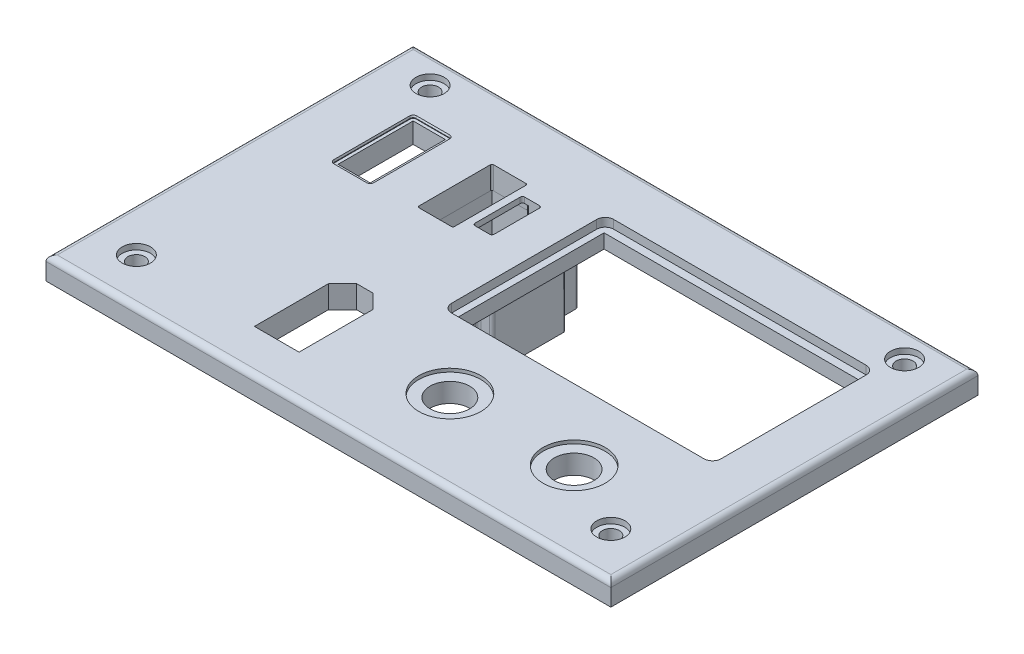
from build123d import *
from OCP.BRepFilletAPI import BRepFilletAPI_MakeChamfer

# Parameters (mm, degrees)
SKETCH_1_W             = 100
SKETCH_1_H             = 65
EXTRUDE_307_DEPTH      = 4
SKETCH_2_W             = 47.7
SKETCH_2_H             = 28.7
CUT_EXTRUDE_542_DEPTH  = 1.5
FILLET_597_R           = 1.5
SKETCH_3_W             = 45.3
SKETCH_3_H             = 25.9
CUT_EXTRUDE_1214_DEPTH = 3
SKETCH_5_R             = 5.5
CUT_EXTRUDE_1569_DEPTH = 0.6
SKETCH_7_W             = 6.8
SKETCH_7_H             = 14.4
USB_DEPTH              = 0.4
SKETCH_8_W             = 5.7
SKETCH_8_H             = 13.3
USB_2_DEPTH            = 70.555445509
F_1_USB_R              = 0.5
XT60_DEPTH             = 70.577295147
SKETCH_10_R            = 1.5
CUT_EXTRUDE_3801_DEPTH = 70.577295147
SKETCH_13_R            = 2.5
CUT_EXTRUDE_4325_DEPTH = 1
FILLET_1_R             = 1
CUT_EXTRUDE_1_DEPTH    = 70.577295147
FILLET_2_R             = 0.4
FILLET_3_R             = 0.3
SKETCH_15_W            = 1.3
SKETCH_15_H            = 18.4
EXTRUDE_1_DEPTH        = 1
FILLET_4_R             = 0.3
FILLET_5_R             = 0.4
EXTRUDE_1_2_DEPTH      = 15
FILLET_6_R             = 0.5
SKETCH_18_W            = 1.090661214
SKETCH_18_H            = 18.299056271
CUT_EXTRUDE_2_DEPTH    = 3
CHAMFER_2_SIZE         = 0.139892297
CHAMFER_2_SIZE_2       = 0.3
CHAMFER_3_SIZE         = 0.3
CHAMFER_3_SIZE_2       = 0.139892297
CHAMFER_4_SIZE         = 0.3
CHAMFER_4_SIZE2        = 0.139892297
SKETCH_21_R            = 3.5
CUT_EXTRUDE_3_DEPTH    = 10


with BuildPart() as part:
    # Sketch 1 → Extrude 307 (new body)
    with BuildSketch(Plane(origin=(0, 0, 0), x_dir=(1, 0, 0), z_dir=(0, 1, 0))):
        with Locations((-10, -2.5)):
            Rectangle(SKETCH_1_W, SKETCH_1_H)
    extrude(amount=EXTRUDE_307_DEPTH)

    # Sketch 2 → Cut-Extrude 542 (cut)
    with BuildSketch(Plane(origin=(0, 4, 0), x_dir=(1, 0, 0), z_dir=(0, 1, 0))):
        with Locations((7.15, 6.35)):
            Rectangle(SKETCH_2_W, SKETCH_2_H)
    extrude(amount=-CUT_EXTRUDE_542_DEPTH, mode=Mode.SUBTRACT)

    # Fillet 597
    fillet_597_edges = [part.edges().sort_by_distance(p)[0] for p in [
        (-16.7, 3.25, 8),
        (-16.7, 3.25, -20.7),
        (31, 3.25, -20.7),
        (31, 3.25, 8),
    ]]
    fillet(fillet_597_edges, radius=FILLET_597_R)

    # Sketch 3 → Cut-Extrude 1214 (cut)
    with BuildSketch(Plane(origin=(0, 2.5, 0), x_dir=(1, 0, 0), z_dir=(0, 1, 0))):
        with Locations((7.15, 6.35)):
            Rectangle(SKETCH_3_W, SKETCH_3_H)
    extrude(amount=-CUT_EXTRUDE_1214_DEPTH, mode=Mode.SUBTRACT)

    # Sketch 5 → Cut-Extrude 1569 (cut)
    with BuildSketch(Plane(origin=(0, 4, 0), x_dir=(1, 0, 0), z_dir=(0, 1, 0))):
        with Locations(Location((19, -20.5, 0), (0, 0, 270))):
            Circle(SKETCH_5_R)
        with Locations(Location((-3, -20.5, 0), (0, 0, 270))):
            Circle(SKETCH_5_R)
    extrude(amount=-CUT_EXTRUDE_1569_DEPTH, mode=Mode.SUBTRACT)

    # Sketch 7 → USB (cut)
    with BuildSketch(Plane(origin=(0, 4, 0), x_dir=(1, 0, 0), z_dir=(0, 1, 0))):
        with Locations((-45.6, 11.8)):
            Rectangle(SKETCH_7_W, SKETCH_7_H)
    extrude(amount=-USB_DEPTH, mode=Mode.SUBTRACT)

    # Sketch 8 → USB 2 (cut, through all)
    with BuildSketch(Plane(origin=(0, 3.6, 0), x_dir=(1, 0, 0), z_dir=(0, 1, 0))):
        with Locations((-45.6, 11.8)):
            Rectangle(SKETCH_8_W, SKETCH_8_H)
    extrude(amount=-USB_2_DEPTH, mode=Mode.SUBTRACT)

    # 1 USB
    f_1_usb_edges = [part.edges().sort_by_distance(p)[0] for p in [
        (-42.2, 3.8, -19),
        (-42.2, 3.8, -4.6),
        (-49, 3.8, -4.6),
        (-49, 3.8, -19),
    ]]
    fillet(f_1_usb_edges, radius=F_1_USB_R)

    # Sketch 9 → XT60 (cut, through all)
    with BuildSketch(Plane(origin=(0, 4, 0), x_dir=(1, 0, 0), z_dir=(0, 1, 0))):
        Polygon((-30.6, -27.5), (-22.7, -27.5), (-22.7, -14.4), (-25.2, -11.9), (-28.1, -11.9), (-30.6, -14.4), align=None)
    extrude(amount=-XT60_DEPTH, mode=Mode.SUBTRACT)

    # Sketch 10 → Cut-Extrude 3801 (cut, through all)
    with BuildSketch(Plane(origin=(0, 4, 0), x_dir=(1, 0, 0), z_dir=(0, 1, 0))):
        with Locations(Location((-52, 25, 0), (0, 0, 270))):
            Circle(SKETCH_10_R)
        with Locations(Location((32, 25, 0), (0, 0, 270))):
            Circle(SKETCH_10_R)
        with Locations(Location((32, -27, 0), (0, 0, 270))):
            Circle(SKETCH_10_R)
        with Locations(Location((-52, -27, 0), (0, 0, 270))):
            Circle(SKETCH_10_R)
    extrude(amount=-CUT_EXTRUDE_3801_DEPTH, mode=Mode.SUBTRACT)

    # Sketch 13 → Cut-Extrude 4325 (cut)
    with BuildSketch(Plane(origin=(0, 4, 0), x_dir=(1, 0, 0), z_dir=(0, 1, 0))):
        with Locations(Location((-52, 25, 0), (0, 0, 270))):
            Circle(SKETCH_13_R)
        with Locations(Location((32, 25, 0), (0, 0, 270))):
            Circle(SKETCH_13_R)
        with Locations(Location((32, -27, 0), (0, 0, 270))):
            Circle(SKETCH_13_R)
        with Locations(Location((-52, -27, 0), (0, 0, 270))):
            Circle(SKETCH_13_R)
    extrude(amount=-CUT_EXTRUDE_4325_DEPTH, mode=Mode.SUBTRACT)

    # Fillet 1
    fillet_1_edges = [part.edges().sort_by_distance(p)[0] for p in [
        (-60, 4, 2.5),
        (-10, 4, 35),
        (40, 4, 2.5),
        (-10, 4, -30),
    ]]
    fillet(fillet_1_edges, radius=FILLET_1_R)

    # Sketch 14 → Cut-Extrude 1 (cut, through all)
    with BuildSketch(Plane(origin=(0, 4, 0), x_dir=(1, 0, 0), z_dir=(0, 1, 0))):
        Polygon((-28.2, 5.25), (-34.5, 5.25), (-34.5, 18.45), (-28.2, 18.45), (-28.2, 21), (-26.9, 21.000000245), (-26.9, 16.250000245), (-23.5, 16.250000245), (-23.5, 7.450000245), (-26.9, 7.450000245), (-26.9, 2.700000245), (-28.2, 2.7), align=None)
    extrude(amount=-CUT_EXTRUDE_1_DEPTH, mode=Mode.SUBTRACT)

    # Fillet 2
    fillet_2_edges = [part.edges().sort_by_distance(p)[0] for p in [
        (-23.5, 2, -16.250000245),
        (-23.5, 2, -7.450000245),
    ]]
    fillet(fillet_2_edges, radius=FILLET_2_R)

    # Fillet 3
    fillet_3_edges = [part.edges().sort_by_distance(p)[0] for p in [
        (-34.5, 2, -5.25),
        (-34.5, 2, -18.45),
    ]]
    fillet(fillet_3_edges, radius=FILLET_3_R)

    # Sketch 15 → Extrude 1 (add)
    with BuildSketch(Plane(origin=(0, 4, 0), x_dir=(1, 0, 0), z_dir=(0, 1, 0))):
        with Locations((-27.55, 11.900000122)):
            Rectangle(SKETCH_15_W, SKETCH_15_H)
    extrude(amount=-EXTRUDE_1_DEPTH)

    # Fillet 4
    fillet_4_edges = [part.edges().sort_by_distance(p)[0] for p in [
        (-28.2, 3.5, -5.25),
        (-28.2, 3.5, -18.45),
    ]]
    fillet(fillet_4_edges, radius=FILLET_4_R)

    # Fillet 5
    fillet_5_edges = [part.edges().sort_by_distance(p)[0] for p in [
        (-26.9, 3.5, -16.250000245),
        (-26.9, 3.5, -7.450000245),
    ]]
    fillet(fillet_5_edges, radius=FILLET_5_R)

    # Sketch 17 → Extrude 1 2 (add)
    with BuildSketch(Plane.XZ):
        Polygon((-36.618386658, -3.143776534), (-30.309338786, -3.143776534), (-30.309338786, -0.700943974), (-23.809338786, -0.700943974), (-23.809338786, -5.317320465), (-21.309338786, -5.317320465), (-21.309338786, -18.393213758), (-23.809338786, -18.393213758), (-23.809338786, -23.1022888), (-30.309338786, -23.1022888), (-30.309338786, -20.556223466), (-36.618386658, -20.556223466), align=None)
        Polygon((-34.618386658, -5.143776534), (-28.309338786, -5.143776534), (-28.309338786, -2.700943974), (-25.809338786, -2.700943974), (-25.809338786, -7.317320465), (-23.309338786, -7.317320465), (-23.309338786, -16.393213758), (-25.809338786, -16.393213758), (-25.809338786, -21.1022888), (-28.309338786, -21.1022888), (-28.309338786, -18.556223466), (-34.618386658, -18.556223466), align=None, mode=Mode.SUBTRACT)
    extrude(amount=EXTRUDE_1_2_DEPTH)

    # Fillet 6
    fillet_6_edges = [part.edges().sort_by_distance(p)[0] for p in [
        (-36.618386658, -7.5, -3.143776534),
        (-36.618386658, -7.5, -20.556223466),
        (-30.309338786, -7.5, -20.556223466),
        (-30.309338786, -7.5, -23.1022888),
        (-23.809338786, -7.5, -23.1022888),
        (-23.809338786, -7.5, -18.393213758),
        (-21.309338786, -7.5, -18.393213758),
        (-21.309338786, -7.5, -5.317320465),
        (-23.809338786, -7.5, -5.317320465),
        (-23.809338786, -7.5, -0.700943974),
        (-30.309338786, -7.5, -0.700943974),
        (-30.309338786, -7.5, -3.143776534),
    ]]
    fillet(fillet_6_edges, radius=FILLET_6_R)

    # Sketch 18 → Cut-Extrude 2 (cut)
    with BuildSketch(Plane.XZ):
        with Locations((-26.354669393, -11.85047211)):
            Rectangle(SKETCH_18_W, SKETCH_18_H)
    extrude(amount=-CUT_EXTRUDE_2_DEPTH, mode=Mode.SUBTRACT)

    # Chamfer 2
    # the kernel refuses this chamfer: 0.3, 0.139892297 mm, written as the material it takes off along each edge
    with BuildSketch(Plane(origin=(-23.5, 0, -7.850000245), x_dir=(0.9971975577536777, -0.07481330637059809, 0), z_dir=(0, 0, -1))) as chamfer_2_piece_1:
        Polygon((CHAMFER_2_SIZE * 0.997197560936, -CHAMFER_2_SIZE * 0.0748133066094), (-CHAMFER_2_SIZE_2 * 0.0748133063706, -CHAMFER_2_SIZE_2 * 0.997197557754), (0, 0), align=None)
    extrude(amount=8, mode=Mode.SUBTRACT)
    with BuildSketch(Plane(origin=(-23.9, 0, -16.250000245), x_dir=(0, -0.07481330637059809, -0.9971975577536777), z_dir=(-1, 0, 0))) as chamfer_2_piece_2:
        Polygon((CHAMFER_2_SIZE * 0.997197560936, -CHAMFER_2_SIZE * 0.0748133066094), (-CHAMFER_2_SIZE_2 * 0.0748133063706, -CHAMFER_2_SIZE_2 * 0.997197557754), (0, 0), align=None)
    extrude(amount=2.686631428, mode=Mode.SUBTRACT)
    with BuildSketch(Plane(origin=(-23.9, 0, -7.850000245), x_dir=(1, 0, 0), z_dir=(0, 0, -1))) as chamfer_2_piece_3_section:
        Polygon((0.4 + CHAMFER_2_SIZE * 1.00000000319, 0), (0.4, -CHAMFER_2_SIZE_2), (0.4, 0), align=None)
    chamfer_2_piece_3 = revolve(axis=Axis((-23.9, 0, -7.850000245), (0, -1, 0)), revolution_arc=90, mode=Mode.PRIVATE)
    chamfer_2_piece_3 = split(chamfer_2_piece_3, bisect_by=Plane(origin=(-23.615169446, 0.09811856, -7.317320465), z_dir=(0, 0, -1)), keep=Keep.TOP, mode=Mode.PRIVATE)
    add(chamfer_2_piece_3, mode=Mode.SUBTRACT)
    with BuildSketch(Plane(origin=(-23.9, 0, -15.850000245), x_dir=(0, 0, -1), z_dir=(-1, 0, 0))) as chamfer_2_piece_4:
        Polygon((0.4 + CHAMFER_2_SIZE * 1.00000000319, 0), (0.4, -CHAMFER_2_SIZE_2), (0.4, 0), align=None)
    revolve(axis=Axis((-23.9, 0, -15.850000245), (0, -1, 0)), revolution_arc=90, mode=Mode.SUBTRACT)
    with BuildSketch(Plane(origin=(-26.586631428, 0, -7.450000245), x_dir=(0, -0.07481330637059899, 0.9971975577536775), z_dir=(1, 0, 0))) as chamfer_2_piece_5_section:
        Polygon((CHAMFER_2_SIZE * 0.997197560936, -CHAMFER_2_SIZE * 0.0748133066094), (-CHAMFER_2_SIZE_2 * 0.0748133063706, -CHAMFER_2_SIZE_2 * 0.997197557754), (0, 0), align=None)
    chamfer_2_piece_5 = extrude(amount=2.686631428, mode=Mode.PRIVATE)
    chamfer_2_piece_5 = split(chamfer_2_piece_5, bisect_by=Plane(origin=(-25.243315714, 0.102442856, -7.317320465), z_dir=(0, 0, -1)), keep=Keep.TOP, mode=Mode.PRIVATE)
    add(chamfer_2_piece_5, mode=Mode.SUBTRACT)

    # Chamfer 3
    # the kernel refuses this chamfer: 0.3, 0.139892297 mm, written as the material it takes off along each edge
    with BuildSketch(Plane(origin=(-26.9, 0, -21.000000245), x_dir=(3.0703872584113996e-09, 0.9998669641130701, 0.01631116413112706), z_dir=(-0.9999999999999823, 0, 1.8823838897875096e-07))) as chamfer_3_piece_1_section:
        Polygon((CHAMFER_3_SIZE * 0.999866964113, CHAMFER_3_SIZE * 0.0163111641311), (-CHAMFER_3_SIZE_2 * 0.0163111641832, CHAMFER_3_SIZE_2 * 0.999866967304), (0, 0), align=None)
    chamfer_3_piece_1 = extrude(amount=1.3, mode=Mode.PRIVATE)
    chamfer_3_piece_1 = split(chamfer_3_piece_1, bisect_by=Plane(origin=(-27.550000111, 0.109074509, -21.1022888), z_dir=(0, 0, 1)), keep=Keep.TOP, mode=Mode.PRIVATE)
    add(chamfer_3_piece_1, mode=Mode.SUBTRACT)
    with BuildSketch(Plane(origin=(-28.2, 0, -21), x_dir=(0.016311164131115632, 0.9998669641130703, 0), z_dir=(0, 0, 1))) as chamfer_3_piece_2_section:
        Polygon((CHAMFER_3_SIZE * 0.999866964113, CHAMFER_3_SIZE * 0.0163111641311), (-CHAMFER_3_SIZE_2 * 0.0163111641832, CHAMFER_3_SIZE_2 * 0.999866967304), (0, 0), align=None)
    chamfer_3_piece_2 = extrude(amount=3.327292641, mode=Mode.PRIVATE)
    chamfer_3_piece_2 = split(chamfer_3_piece_2, bisect_by=Plane(origin=(-28.309338786, 0.10709581, -19.77811173), z_dir=(1, 0, 0)), keep=Keep.TOP, mode=Mode.PRIVATE)
    chamfer_3_piece_2 = split(chamfer_3_piece_2, bisect_by=Plane(origin=(-28.239160304, 0.10709581, -18.556223466), z_dir=(0, 0, -1)), keep=Keep.TOP, mode=Mode.PRIVATE)
    add(chamfer_3_piece_2, mode=Mode.SUBTRACT)
    with BuildSketch(Plane(origin=(-28.2, 0, -21), x_dir=(0.016311164131115632, 0.9998669641130703, 0), z_dir=(0, 0, 1))) as chamfer_3_piece_3_section:
        Polygon((CHAMFER_3_SIZE * 0.999866964113, CHAMFER_3_SIZE * 0.0163111641311), (-CHAMFER_3_SIZE_2 * 0.0163111641832, CHAMFER_3_SIZE_2 * 0.999866967304), (0, 0), align=None)
    chamfer_3_piece_3 = extrude(amount=3.327292641, mode=Mode.PRIVATE)
    chamfer_3_piece_3 = split(chamfer_3_piece_3, bisect_by=Plane(origin=(-28.309338786, 0.10709581, -18.114465412), z_dir=(1, 0, 0)), keep=Keep.TOP, mode=Mode.PRIVATE)
    chamfer_3_piece_3 = split(chamfer_3_piece_3, bisect_by=Plane(origin=(-28.239160304, 0.10709581, -18.556223466), z_dir=(0, 0, 1)), keep=Keep.TOP, mode=Mode.PRIVATE)
    add(chamfer_3_piece_3, mode=Mode.SUBTRACT)
    with BuildSketch(Plane(origin=(-28.2, 0, -21), x_dir=(0.016311164131115632, 0.9998669641130703, 0), z_dir=(0, 0, 1))) as chamfer_3_piece_4_section:
        Polygon((CHAMFER_3_SIZE * 0.999866964113, CHAMFER_3_SIZE * 0.0163111641311), (-CHAMFER_3_SIZE_2 * 0.0163111641832, CHAMFER_3_SIZE_2 * 0.999866967304), (0, 0), align=None)
    chamfer_3_piece_4 = extrude(amount=3.327292641, mode=Mode.PRIVATE)
    chamfer_3_piece_4 = split(chamfer_3_piece_4, bisect_by=Plane(origin=(-28.309338786, 0.012963641, -18.114465412), z_dir=(-1, 0, 0)), keep=Keep.TOP, mode=Mode.PRIVATE)
    chamfer_3_piece_4 = split(chamfer_3_piece_4, bisect_by=Plane(origin=(-28.322057693, 0.012963641, -18.556223466), z_dir=(0, 0, 1)), keep=Keep.TOP, mode=Mode.PRIVATE)
    add(chamfer_3_piece_4, mode=Mode.SUBTRACT)
    with BuildSketch(Plane(origin=(-26.9, 0, -21.000000245), x_dir=(0, 0.9998669641130703, 0.016311164131115625), z_dir=(1, 0, 0))) as chamfer_3_piece_5_section:
        Polygon((CHAMFER_3_SIZE * 0.999866964113, -CHAMFER_3_SIZE * 0.0163111641311), (-CHAMFER_3_SIZE_2 * 0.0163111641832, -CHAMFER_3_SIZE_2 * 0.999866967304), (0, 0), align=None)
    chamfer_3_piece_5 = extrude(amount=1.090661214, mode=Mode.PRIVATE)
    chamfer_3_piece_5 = split(chamfer_3_piece_5, bisect_by=Plane(origin=(-26.354669393, 0.109074546, -21.1022888), z_dir=(0, 0, 1)), keep=Keep.TOP, mode=Mode.PRIVATE)
    add(chamfer_3_piece_5, mode=Mode.SUBTRACT)
    with BuildSketch(Plane(origin=(-26.9, 0, -21.000000245), x_dir=(3.0703872584113996e-09, 0.9998669641130701, 0.01631116413112706), z_dir=(-0.9999999999999823, 0, 1.8823838897875096e-07))) as chamfer_3_piece_6a_section:
        Polygon((CHAMFER_3_SIZE * 0.999866964113, CHAMFER_3_SIZE * 0.0163111641311), (-CHAMFER_3_SIZE_2 * 0.0163111641832, CHAMFER_3_SIZE_2 * 0.999866967304), (0, 0), align=None)
    chamfer_3_piece_6a = extrude(amount=2.077292641, mode=Mode.PRIVATE)
    chamfer_3_piece_6a = split(chamfer_3_piece_6a, bisect_by=Plane(origin=(-28.254669395, 0.10907447, -21.1022888), z_dir=(0, 0, 1)), keep=Keep.TOP, mode=Mode.PRIVATE)
    chamfer_3_piece_6a = split(chamfer_3_piece_6a, bisect_by=Plane(origin=(-28.309338786, 0.10907447, -21.037410409), z_dir=(1, 0, 0)), keep=Keep.TOP, mode=Mode.PRIVATE)
    chamfer_3_piece_6a = split(chamfer_3_piece_6a, bisect_by=Plane(origin=(-28.2, 0.10907447, -21.037410409), z_dir=(-1, 0, 0)), keep=Keep.TOP, mode=Mode.PRIVATE)
    with BuildSketch(Plane(origin=(-28.2, 0, -21.777292641), x_dir=(0.016311164131115632, 0.9998669641130703, 0), z_dir=(0, 0, 1))) as chamfer_3_piece_6b_section:
        Polygon((CHAMFER_3_SIZE * 0.999866964113, CHAMFER_3_SIZE * 0.0163111641311), (-CHAMFER_3_SIZE_2 * 0.0163111641832, CHAMFER_3_SIZE_2 * 0.999866967304), (0, 0), align=None)
    chamfer_3_piece_6b = extrude(amount=4.104585283, mode=Mode.PRIVATE)
    chamfer_3_piece_6b = split(chamfer_3_piece_6b, bisect_by=Plane(origin=(-28.239160306, 0.107095809, -21.1022888), z_dir=(0, 0, 1)), keep=Keep.TOP, mode=Mode.PRIVATE)
    chamfer_3_piece_6b = split(chamfer_3_piece_6b, bisect_by=Plane(origin=(-28.309338786, 0.107095809, -21.051144397), z_dir=(1, 0, 0)), keep=Keep.TOP, mode=Mode.PRIVATE)
    chamfer_3_piece_6b = split(chamfer_3_piece_6b, bisect_by=Plane(origin=(-28.239160296, 0.107095809, -20.999999993), z_dir=(-1.8823838897875096e-07, 0, -0.9999999999999823)), keep=Keep.TOP, mode=Mode.PRIVATE)
    chamfer_3_piece_6 = chamfer_3_piece_6a & chamfer_3_piece_6b
    add(chamfer_3_piece_6, mode=Mode.SUBTRACT)

    # Chamfer 4: one chamfer whose edges measure the first distance from different faces: ONE call of the kernel's chamfer builder (chamfer() names one face for all edges)
    chamfer_4_edges_1 = [part.edges().sort_by_distance(p)[0] for p in [
        (-45.6, 4, -4.6),
    ]]
    chamfer_4_side_1 = [part.faces().sort_by_distance(p)[0] for p in [
        (-45.6, 3.8, -4.6),
    ]]
    chamfer_4_edges_2 = [part.edges().sort_by_distance(p)[0] for p in [
        (-49, 4, -11.8),
    ]]
    chamfer_4_side_2 = [part.faces().sort_by_distance(p)[0] for p in [
        (-49, 3.8, -11.8),
    ]]
    chamfer_4_edges_3 = [part.edges().sort_by_distance(p)[0] for p in [
        (-42.2, 4, -11.8),
    ]]
    chamfer_4_side_3 = [part.faces().sort_by_distance(p)[0] for p in [
        (-42.2, 3.8, -11.8),
    ]]
    chamfer_4_edges_4 = [part.edges().sort_by_distance(p)[0] for p in [
        (-45.6, 4, -19),
    ]]
    chamfer_4_side_4 = [part.faces().sort_by_distance(p)[0] for p in [
        (-45.6, 3.8, -19),
    ]]
    chamfer_4_edges_5 = [part.edges().sort_by_distance(p)[0] for p in [
        (-48.853553391, 4, -4.746446609),
    ]]
    chamfer_4_side_5 = [part.faces().sort_by_distance(p)[0] for p in [
        (-48.853553391, 3.8, -4.746446609),
    ]]
    chamfer_4_edges_6 = [part.edges().sort_by_distance(p)[0] for p in [
        (-42.346446609, 4, -4.746446609),
    ]]
    chamfer_4_side_6 = [part.faces().sort_by_distance(p)[0] for p in [
        (-42.346446609, 3.8, -4.746446609),
    ]]
    chamfer_4_edges_7 = [part.edges().sort_by_distance(p)[0] for p in [
        (-42.346446609, 4, -18.853553391),
    ]]
    chamfer_4_side_7 = [part.faces().sort_by_distance(p)[0] for p in [
        (-42.346446609, 3.8, -18.853553391),
    ]]
    chamfer_4_edges_8 = [part.edges().sort_by_distance(p)[0] for p in [
        (-48.853553391, 4, -18.853553391),
    ]]
    chamfer_4_side_8 = [part.faces().sort_by_distance(p)[0] for p in [
        (-48.853553391, 3.8, -18.853553391),
    ]]
    chamfer_4 = BRepFilletAPI_MakeChamfer(part.part.solid().wrapped)
    for e in chamfer_4_edges_1:
        chamfer_4.Add(CHAMFER_4_SIZE, CHAMFER_4_SIZE2, e.wrapped, chamfer_4_side_1[0].wrapped)  # the first distance lies on this face
    for e in chamfer_4_edges_2:
        chamfer_4.Add(CHAMFER_4_SIZE, CHAMFER_4_SIZE2, e.wrapped, chamfer_4_side_2[0].wrapped)  # the first distance lies on this face
    for e in chamfer_4_edges_3:
        chamfer_4.Add(CHAMFER_4_SIZE, CHAMFER_4_SIZE2, e.wrapped, chamfer_4_side_3[0].wrapped)  # the first distance lies on this face
    for e in chamfer_4_edges_4:
        chamfer_4.Add(CHAMFER_4_SIZE, CHAMFER_4_SIZE2, e.wrapped, chamfer_4_side_4[0].wrapped)  # the first distance lies on this face
    for e in chamfer_4_edges_5:
        chamfer_4.Add(CHAMFER_4_SIZE, CHAMFER_4_SIZE2, e.wrapped, chamfer_4_side_5[0].wrapped)  # the first distance lies on this face
    for e in chamfer_4_edges_6:
        chamfer_4.Add(CHAMFER_4_SIZE, CHAMFER_4_SIZE2, e.wrapped, chamfer_4_side_6[0].wrapped)  # the first distance lies on this face
    for e in chamfer_4_edges_7:
        chamfer_4.Add(CHAMFER_4_SIZE, CHAMFER_4_SIZE2, e.wrapped, chamfer_4_side_7[0].wrapped)  # the first distance lies on this face
    for e in chamfer_4_edges_8:
        chamfer_4.Add(CHAMFER_4_SIZE, CHAMFER_4_SIZE2, e.wrapped, chamfer_4_side_8[0].wrapped)  # the first distance lies on this face
    add(Compound.cast(chamfer_4.Shape()), mode=Mode.REPLACE)

    # Sketch 21 → Cut-Extrude 3 (cut)
    with BuildSketch(Plane(origin=(0, 3.4, 0), x_dir=(1, 0, 0), z_dir=(0, 1, 0))):
        with Locations(Location((-3, -20.5, 0), (0, 0, 270))):
            Circle(SKETCH_21_R)
        with Locations(Location((19, -20.5, 0), (0, 0, 270))):
            Circle(SKETCH_21_R)
    extrude(amount=-CUT_EXTRUDE_3_DEPTH, mode=Mode.SUBTRACT)


solid = part.part
